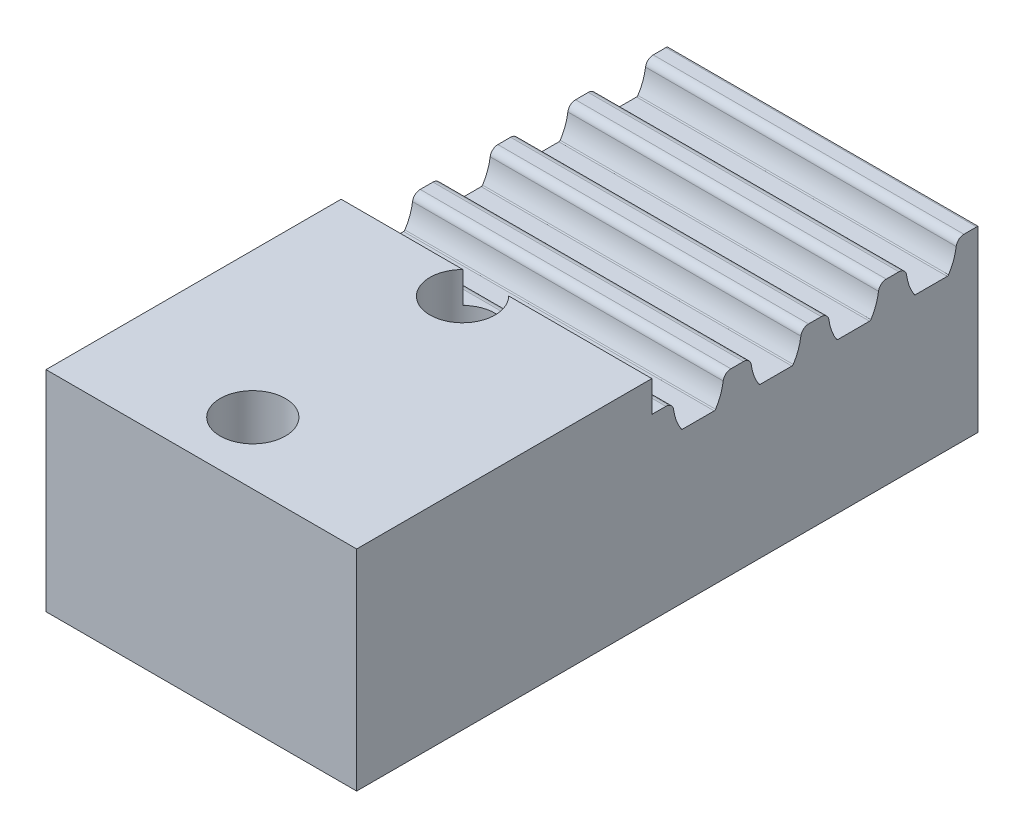
from build123d import *

# Parameters (mm, degrees)
DELETE_START           = -13.5
DELETE_FACE_1_DEPTH    = 27
MOVE_FACE_1_BY         = 7
MOVE_FACE_2_BY         = 5.5
SKETCH_2_W             = 48.263019836
SKETCH_2_H             = 43.058184364
CUT_EXTRUDE_1_DEPTH    = 20
EXTRUDE_1_DEPTH        = 2
EXTRUDE_1_DEPTH_BACK   = 5
SKETCH_3_W             = 20
SKETCH_3_H             = 19
HOLE_WIZARD_M5_1_D     = 4.2
HOLE_WIZARD_M5_1_DEPTH = 20
HOLE_WIZARD_M5_1_TIP   = 1.2618073


with BuildPart() as part:
    # Delete Face 1: read off the stored shape, not the designer's step
    # Delete Face 1 outline → Delete Face 1 (new body)
    with BuildSketch(Plane.YZ.offset(DELETE_START)):
        with BuildLine():
            ThreePointArc((-8.364285714, 23.895568572), (-8.397831007, 23.931741933), (-8.41, 23.979551078))
            Line((-8.41, 23.979551078), (-8.41, 26.020448922))
            ThreePointArc((-8.41, 26.020448922), (-8.397831007, 26.068258067), (-8.364285714, 26.104431428))
            ThreePointArc((-8.364285714, 26.104431428), (-7.725958169, 26.423724028), (-7.033327746, 26.595982314))
            ThreePointArc((-7.033327746, 26.595982314), (-6.723611818, 26.762379014), (-6.6, 27.091517187))
            Line((-6.6, 27.091517187), (-6.6, 27.908482813))
            ThreePointArc((-6.6, 27.908482813), (-6.723615527, 28.237625227), (-7.033338915, 28.404019189))
            ThreePointArc((-7.033338915, 28.404019189), (-7.725963455, 28.576277924), (-8.364285714, 28.895568572))
            ThreePointArc((-8.364285714, 28.895568572), (-8.397831007, 28.931741933), (-8.41, 28.979551078))
            Line((-8.41, 28.979551078), (-8.41, 31.020448922))
            ThreePointArc((-8.41, 31.020448922), (-8.397831007, 31.068258067), (-8.364285714, 31.104431428))
            ThreePointArc((-8.364285714, 31.104431428), (-7.725958168, 31.423724029), (-7.033327744, 31.595982314))
            ThreePointArc((-7.033327744, 31.595982314), (-6.723611817, 31.762379015), (-6.6, 32.091517187))
            Line((-6.6, 32.091517187), (-6.6, 32.908482813))
            ThreePointArc((-6.6, 32.908482813), (-6.602116164, 32.954435895), (-6.608446743, 33))
            Line((-6.608446743, 33), (-12.6, 33))
            Line((-12.6, 33), (-12.6, -33))
            Line((-12.6, -33), (-6.608446743, -33))
            ThreePointArc((-6.608446743, -33), (-6.602116164, -32.954435895), (-6.6, -32.908482813))
            Line((-6.6, -32.908482813), (-6.6, -32.091517187))
            ThreePointArc((-6.6, -32.091517187), (-6.723615531, -31.762374768), (-7.033338927, -31.595980809))
            ThreePointArc((-7.033338927, -31.595980809), (-7.72596346, -31.423722074), (-8.364285714, -31.104431428))
            ThreePointArc((-8.364285714, -31.104431428), (-8.397831007, -31.068258067), (-8.41, -31.020448922))
            Line((-8.41, -31.020448922), (-8.41, -28.979551078))
            ThreePointArc((-8.41, -28.979551078), (-8.397831007, -28.931741933), (-8.364285714, -28.895568572))
            ThreePointArc((-8.364285714, -28.895568572), (-7.725958168, -28.576275971), (-7.033327744, -28.404017686))
            ThreePointArc((-7.033327744, -28.404017686), (-6.723611817, -28.237620985), (-6.6, -27.908482813))
            Line((-6.6, -27.908482813), (-6.6, -27.091517187))
            ThreePointArc((-6.6, -27.091517187), (-6.723615528, -26.762374772), (-7.033338917, -26.595980811))
            ThreePointArc((-7.033338917, -26.595980811), (-7.725963456, -26.423722076), (-8.364285714, -26.104431428))
            ThreePointArc((-8.364285714, -26.104431428), (-8.397831007, -26.068258067), (-8.41, -26.020448922))
            Line((-8.41, -26.020448922), (-8.41, -23.979551078))
            ThreePointArc((-8.41, -23.979551078), (-8.397831007, -23.931741933), (-8.364285714, -23.895568572))
            ThreePointArc((-8.364285714, -23.895568572), (-7.725958169, -23.576275972), (-7.033327746, -23.404017686))
            ThreePointArc((-7.033327746, -23.404017686), (-6.723611818, -23.237620986), (-6.6, -22.908482813))
            Line((-6.6, -22.908482813), (-6.6, -22.091517187))
            ThreePointArc((-6.6, -22.091517187), (-6.723615529, -21.76237477), (-7.033338921, -21.59598081))
            ThreePointArc((-7.033338921, -21.59598081), (-7.725963458, -21.423722075), (-8.364285714, -21.104431428))
            ThreePointArc((-8.364285714, -21.104431428), (-8.397831007, -21.068258067), (-8.41, -21.020448922))
            Line((-8.41, -21.020448922), (-8.41, -18.979551078))
            ThreePointArc((-8.41, -18.979551078), (-8.397831007, -18.931741933), (-8.364285714, -18.895568572))
            ThreePointArc((-8.364285714, -18.895568572), (-7.725958168, -18.576275971), (-7.033327744, -18.404017686))
            ThreePointArc((-7.033327744, -18.404017686), (-6.723611817, -18.237620985), (-6.6, -17.908482813))
            Line((-6.6, -17.908482813), (-6.6, -17.091517187))
            ThreePointArc((-6.6, -17.091517187), (-6.723615531, -16.762374768), (-7.033338926, -16.595980809))
            ThreePointArc((-7.033338926, -16.595980809), (-7.72596346, -16.423722074), (-8.364285714, -16.104431428))
            ThreePointArc((-8.364285714, -16.104431428), (-8.397831007, -16.068258067), (-8.41, -16.020448922))
            Line((-8.41, -16.020448922), (-8.41, -13.979551078))
            ThreePointArc((-8.41, -13.979551078), (-8.397831007, -13.931741933), (-8.364285714, -13.895568572))
            ThreePointArc((-8.364285714, -13.895568572), (-7.725958337, -13.576276034), (-7.033328102, -13.404017734))
            ThreePointArc((-7.033328102, -13.404017734), (-6.723611936, -13.237621121), (-6.6, -12.908482813))
            Line((-6.6, -12.908482813), (-6.6, -12.091517187))
            ThreePointArc((-6.6, -12.091517187), (-6.723615532, -11.762374767), (-7.033338929, -11.595980809))
            ThreePointArc((-7.033338929, -11.595980809), (-7.725963462, -11.423722074), (-8.364285714, -11.104431428))
            ThreePointArc((-8.364285714, -11.104431428), (-8.397831007, -11.068258067), (-8.41, -11.020448922))
            Line((-8.41, -11.020448922), (-8.41, -8.979551078))
            ThreePointArc((-8.41, -8.979551078), (-8.397831007, -8.931741933), (-8.364285714, -8.895568572))
            ThreePointArc((-8.364285714, -8.895568572), (-7.725958524, -8.576276103), (-7.033328496, -8.404017787))
            ThreePointArc((-7.033328496, -8.404017787), (-6.723612067, -8.23762127), (-6.6, -7.908482813))
            Line((-6.6, -7.908482813), (-6.6, -7.091517187))
            ThreePointArc((-6.6, -7.091517187), (-6.723615306, -6.762375026), (-7.033338249, -6.595980901))
            ThreePointArc((-7.033338249, -6.595980901), (-7.72596314, -6.423722193), (-8.364285714, -6.104431428))
            ThreePointArc((-8.364285714, -6.104431428), (-8.397831007, -6.068258067), (-8.41, -6.020448922))
            Line((-8.41, -6.020448922), (-8.41, -3.979551078))
            ThreePointArc((-8.41, -3.979551078), (-8.397831007, -3.931741933), (-8.364285714, -3.895568572))
            ThreePointArc((-8.364285714, -3.895568572), (-7.725958462, -3.57627608), (-7.033328366, -3.40401777))
            ThreePointArc((-7.033328366, -3.40401777), (-6.723612024, -3.237621221), (-6.6, -2.908482813))
            Line((-6.6, -2.908482813), (-6.6, -2.091517187))
            ThreePointArc((-6.6, -2.091517187), (-6.723615307, -1.762375024), (-7.033338252, -1.5959809))
            ThreePointArc((-7.033338252, -1.5959809), (-7.725963141, -1.423722192), (-8.364285714, -1.104431428))
            ThreePointArc((-8.364285714, -1.104431428), (-8.397831007, -1.068258067), (-8.41, -1.020448922))
            Line((-8.41, -1.020448922), (-8.41, 1.020448922))
            ThreePointArc((-8.41, 1.020448922), (-8.397831007, 1.068258067), (-8.364285714, 1.104431428))
            ThreePointArc((-8.364285714, 1.104431428), (-7.725958462, 1.42372392), (-7.033328366, 1.59598223))
            ThreePointArc((-7.033328366, 1.59598223), (-6.723612024, 1.762378779), (-6.6, 2.091517187))
            Line((-6.6, 2.091517187), (-6.6, 2.908482813))
            ThreePointArc((-6.6, 2.908482813), (-6.723615307, 3.237624975), (-7.033338252, 3.4040191))
            ThreePointArc((-7.033338252, 3.4040191), (-7.725963141, 3.576277808), (-8.364285714, 3.895568572))
            ThreePointArc((-8.364285714, 3.895568572), (-8.397831007, 3.931741933), (-8.41, 3.979551078))
            Line((-8.41, 3.979551078), (-8.41, 6.020448922))
            ThreePointArc((-8.41, 6.020448922), (-8.397831007, 6.068258067), (-8.364285714, 6.104431428))
            ThreePointArc((-8.364285714, 6.104431428), (-7.725958469, 6.423723918), (-7.03332838, 6.595982228))
            ThreePointArc((-7.03332838, 6.595982228), (-6.723612029, 6.762378774), (-6.6, 7.091517187))
            Line((-6.6, 7.091517187), (-6.6, 7.908482813))
            ThreePointArc((-6.6, 7.908482813), (-6.723615311, 8.23762498), (-7.033338263, 8.404019101))
            ThreePointArc((-7.033338263, 8.404019101), (-7.725963146, 8.57627781), (-8.364285714, 8.895568572))
            ThreePointArc((-8.364285714, 8.895568572), (-8.397831007, 8.931741933), (-8.41, 8.979551078))
            Line((-8.41, 8.979551078), (-8.41, 11.020448922))
            ThreePointArc((-8.41, 11.020448922), (-8.397831007, 11.068258067), (-8.364285714, 11.104431428))
            ThreePointArc((-8.364285714, 11.104431428), (-7.725958337, 11.423723966), (-7.033328101, 11.595982266))
            ThreePointArc((-7.033328101, 11.595982266), (-6.723611936, 11.76237888), (-6.6, 12.091517187))
            Line((-6.6, 12.091517187), (-6.6, 12.908482813))
            ThreePointArc((-6.6, 12.908482813), (-6.72361553, 13.237625231), (-7.033338924, 13.40401919))
            ThreePointArc((-7.033338924, 13.40401919), (-7.725963459, 13.576277925), (-8.364285714, 13.895568572))
            ThreePointArc((-8.364285714, 13.895568572), (-8.397831007, 13.931741933), (-8.41, 13.979551078))
            Line((-8.41, 13.979551078), (-8.41, 16.020448922))
            ThreePointArc((-8.41, 16.020448922), (-8.397831007, 16.068258067), (-8.364285714, 16.104431428))
            ThreePointArc((-8.364285714, 16.104431428), (-7.725958169, 16.423724029), (-7.033327745, 16.595982314))
            ThreePointArc((-7.033327745, 16.595982314), (-6.723611818, 16.762379015), (-6.6, 17.091517187))
            Line((-6.6, 17.091517187), (-6.6, 17.908482813))
            ThreePointArc((-6.6, 17.908482813), (-6.72361553, 18.23762523), (-7.033338923, 18.40401919))
            ThreePointArc((-7.033338923, 18.40401919), (-7.725963459, 18.576277925), (-8.364285714, 18.895568572))
            ThreePointArc((-8.364285714, 18.895568572), (-8.397831007, 18.931741933), (-8.41, 18.979551078))
            Line((-8.41, 18.979551078), (-8.41, 21.020448922))
            ThreePointArc((-8.41, 21.020448922), (-8.397831007, 21.068258067), (-8.364285714, 21.104431428))
            ThreePointArc((-8.364285714, 21.104431428), (-7.725958168, 21.423724029), (-7.033327744, 21.595982314))
            ThreePointArc((-7.033327744, 21.595982314), (-6.723611817, 21.762379015), (-6.6, 22.091517187))
            Line((-6.6, 22.091517187), (-6.6, 22.908482813))
            ThreePointArc((-6.6, 22.908482813), (-6.723615528, 23.237625227), (-7.033338915, 23.404019189))
            ThreePointArc((-7.033338915, 23.404019189), (-7.725963455, 23.576277924), (-8.364285714, 23.895568572))
        make_face()
    extrude(amount=DELETE_FACE_1_DEPTH)

    # Move Face 1: a face moved inward by 7.0
    extrude(part.faces().sort_by_distance((13.5, -10.05864991, 0))[0], amount=MOVE_FACE_1_BY, dir=(-1, 0, 0), mode=Mode.SUBTRACT)

    # Move Face 2: a face moved outward by 5.5
    extrude(part.faces().sort_by_distance((-3.5, -12.6, 0))[0], amount=MOVE_FACE_2_BY, dir=(0, -1, 0))

    # 草图2 → 切除-拉伸1 (cut)
    with BuildSketch(Plane.XZ.offset(18.1)):
        with Locations((-0.503276546, 28.529092182)):
            Rectangle(SKETCH_2_W, SKETCH_2_H)
    extrude(amount=-CUT_EXTRUDE_1_DEPTH, mode=Mode.SUBTRACT)

    # 草图3 → 凸台-拉伸1 (add, two sides: drawn at the far end of the back side and taken through both)
    with BuildSketch(Plane(origin=(0, -6.6, 0), x_dir=(1, 0, 0), z_dir=(0, 1, 0)).offset(-EXTRUDE_1_DEPTH_BACK)):
        with Locations((-3.5, 2.5)):
            Rectangle(SKETCH_3_W, SKETCH_3_H)
    extrude(amount=EXTRUDE_1_DEPTH + EXTRUDE_1_DEPTH_BACK)

    # M5 螺纹孔1
    with Locations(Plane(origin=(-4.186814404, -18.1, 3), x_dir=(0, 0, -1), z_dir=(0, -1, 0))):
        with Locations((0, 0), (13.5, 0)):
            Hole(HOLE_WIZARD_M5_1_D / 2, depth=HOLE_WIZARD_M5_1_DEPTH)
            with Locations((0, 0, -(HOLE_WIZARD_M5_1_DEPTH + HOLE_WIZARD_M5_1_TIP / 2))):  # 118° drill point
                Cone(0, HOLE_WIZARD_M5_1_D / 2, HOLE_WIZARD_M5_1_TIP, mode=Mode.SUBTRACT)


solid = part.part
